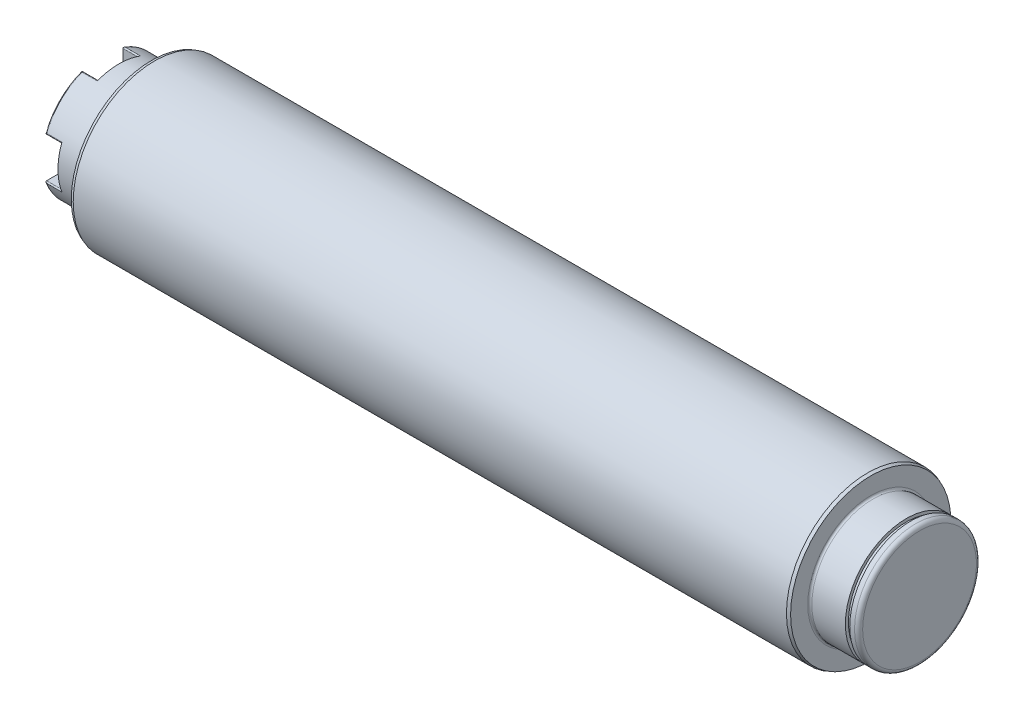
from build123d import *

# Parameters (mm, degrees)
R1_RUNDING_R     = 1
AFFR_SNING_START = -8
AFFR_SNING_DEPTH = 8
R0_5_RUNDINGER_R = 0.5


with BuildPart() as part:
    # Sketch1 → Base-Revolve (revolve)
    with BuildSketch(Plane.XY):
        with BuildLine():
            Line((-201, 20), (-201, 30))
            Line((-201, 30), (-177, 30))
            Line((-177, 30), (-177, 39.454044649))
            Line((-177, 39.454044649), (-175.5, 40))
            Line((-175.5, 40), (175.5, 40))
            Line((175.5, 40), (177, 39.454044649))
            Line((177, 39.454044649), (177, 30))
            Line((177, 30), (194.5, 30))
            Line((194.5, 30), (194.5, 28.5))
            Line((194.5, 28.5), (196.65, 28.5))
            Line((196.65, 28.5), (196.65, 30))
            Line((196.65, 30), (199, 30))
            ThreePointArc((199, 30), (200.414213562, 29.414213562), (201, 28))
            Line((201, 28), (201, 0))
            Line((201, 0), (-146.793975667, 0))
            Line((-146.793975667, 0), (-151, 7))
            Line((-151, 7), (-182.098709071, 7))
            Line((-182.098709071, 7), (-183, 8.5))
            Line((-183, 8.5), (-193, 8.5))
            Line((-193, 8.5), (-193, 20))
            Line((-193, 20), (-201, 20))
        make_face()
    revolve(axis=Axis((-283, 0, 0), (1, 0, 0)))

    # R1 runding
    r1_runding_edges = [part.edges().sort_by_distance(p)[0] for p in [
        (177, -30, 0),
        (-177, -30, 0),
    ]]
    fillet(r1_runding_edges, radius=R1_RUNDING_R)

    # Sketch3 → Affræsning (cut)
    with BuildSketch(Plane.ZY.offset(201).offset(AFFR_SNING_START)):
        with BuildLine():
            Line((10, 28.284271247), (10, 17.320508076))
            ThreePointArc((10, 17.320508076), (0, 20), (-10, 17.320508076))
            Line((-10, 17.320508076), (-10, 28.284271247))
            ThreePointArc((-10, 28.284271247), (0, 30), (10, 28.284271247))
        make_face()
        with BuildLine():
            Line((17.320508076, 10), (28.284271247, 10))
            ThreePointArc((28.284271247, 10), (30, 0), (28.284271247, -10))
            Line((28.284271247, -10), (17.320508076, -10))
            ThreePointArc((17.320508076, -10), (20, 0), (17.320508076, 10))
        make_face()
        with BuildLine():
            Line((-17.320508076, -10), (-28.284271247, -10))
            ThreePointArc((-28.284271247, -10), (-30, 0), (-28.284271247, 10))
            Line((-28.284271247, 10), (-17.320508076, 10))
            ThreePointArc((-17.320508076, 10), (-20, 0), (-17.320508076, -10))
        make_face()
        with BuildLine():
            Line((-10, -28.284271247), (-10, -17.320508076))
            ThreePointArc((-10, -17.320508076), (0, -20), (10, -17.320508076))
            Line((10, -17.320508076), (10, -28.284271247))
            ThreePointArc((10, -28.284271247), (0, -30), (-10, -28.284271247))
        make_face()
    extrude(amount=AFFR_SNING_DEPTH, mode=Mode.SUBTRACT)

    # R0.5 rundinger
    r0_5_rundinger_edges = [part.edges().sort_by_distance(p)[0] for p in [
        (-197, -10, 17.320508076),
        (-197, -17.320508076, 10),
        (-197, 10, -28.284271247),
        (-197, 10, 17.320508076),
        (-197, 17.320508076, 10),
        (-197, -10, -28.284271247),
        (-197, -10, -17.320508076),
        (-197, -17.320508076, -10),
        (-197, -28.284271247, -10),
        (-197, -28.284271247, 10),
        (-197, -10, 28.284271247),
        (-197, 28.284271247, 10),
        (-197, 10, 28.284271247),
        (-197, 10, -17.320508076),
        (-197, 28.284271247, -10),
        (-197, 17.320508076, -10),
        (-201, 21.213203436, -21.213203436),
        (-201, 21.213203436, 21.213203436),
        (-201, -21.213203436, 21.213203436),
        (-201, -21.213203436, -21.213203436),
        (-201, 14.142135624, 14.142135624),
        (-201, -14.142135624, 14.142135624),
        (-201, -14.142135624, -14.142135624),
        (-201, 14.142135624, -14.142135624),
    ]]
    fillet(r0_5_rundinger_edges, radius=R0_5_RUNDINGER_R)


solid = part.part
